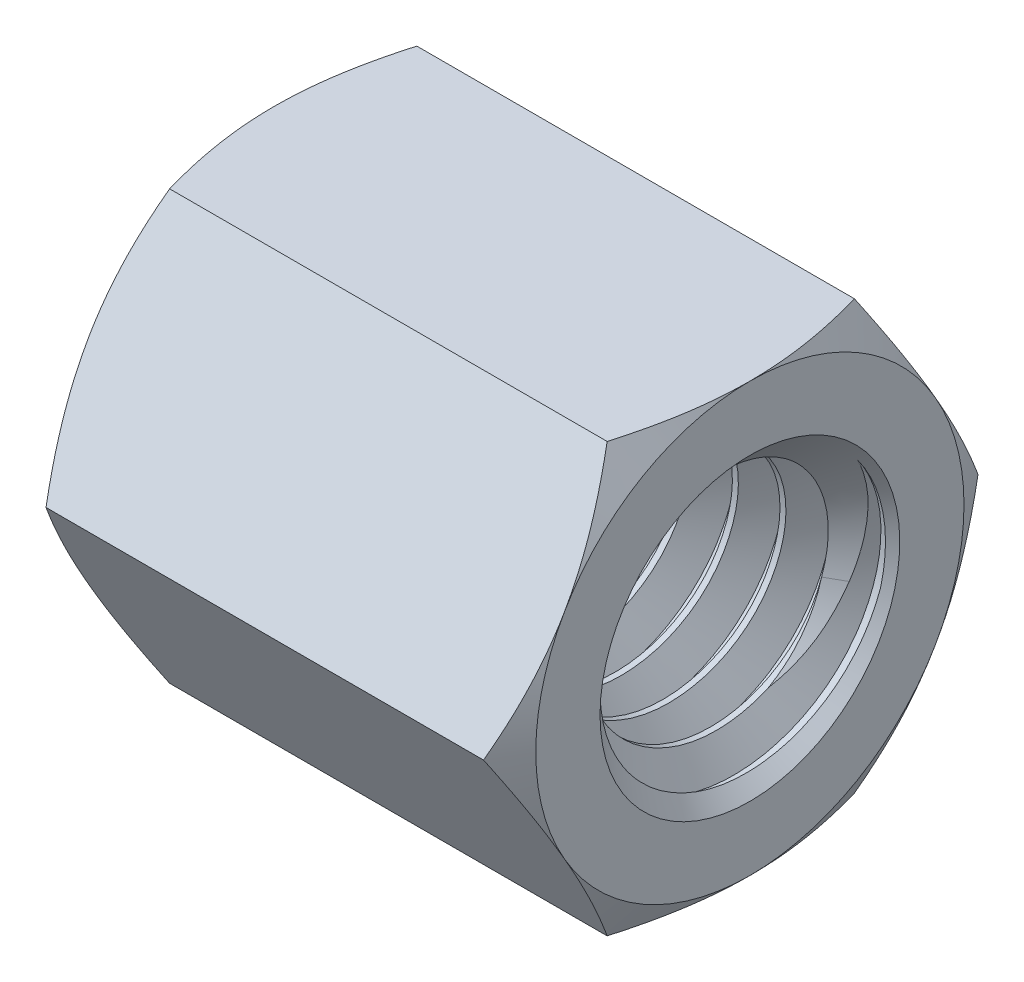
from build123d import *
from build123d.topology import SkipClean

# Parameters (mm, degrees)
BOSS_EXTRUDE1_DEPTH          = 5
SKETCH4_OUTSIDE_W            = 33.378
SKETCH4_OUTSIDE_H            = 32.682
SKETCH4_OUTSIDE_R            = 2.2499999999999987
CUT_EXTRUDE1_DEPTH           = 7.067330549755798
CUT_EXTRUDE1_DRAFT           = -60.000000000000135
SKETCH5_OUTSIDE_W            = 33.378
SKETCH5_OUTSIDE_H            = 32.682
SKETCH5_OUTSIDE_R            = 2.2499999999999987
CUT_EXTRUDE2_DEPTH           = 7.067330549755797
CUT_EXTRUDE2_DRAFT           = -60.000000000000135
SWEEP1_PITCH                 = 0.49999999999999784
SWEEP1_HEIGHT                = 5.500000000000004
SWEEP1_RADIUS                = 1.5000000000000002
SWEEP1_START_ANGLE           = -90.0000000000002
SKETCH8_R                    = 1.5750000000000002
CUT_EXTRUDE3_OTHER_WAY_DEPTH = 7.500868463312053
CUT_EXTRUDE3_OTHER_WAY_TAPER = -45.0000000000001
SKETCH9_R                    = 1.5750000000000002
CUT_EXTRUDE4_OTHER_WAY_DEPTH = 7.067330632164362
CUT_EXTRUDE4_OTHER_WAY_TAPER = -45.0000000000001


with BuildPart() as part:
    # Sketch2 → Boss-Extrude1 (new body)
    with BuildSketch(Plane(origin=(0, 0, 0), x_dir=(0, 0, -1), z_dir=(1, 0, 0))):
        Polygon((1.299038105676657, 2.2499999999999987), (-1.2990381056766587, 2.2499999999999987), (-2.5980762113533147, -1.52e-15), (-1.299038105676657, -2.249999999999999), (1.2990381056766582, -2.2499999999999982), (2.598076211353314, 9.1e-16), align=None)
    extrude(amount=BOSS_EXTRUDE1_DEPTH)

    # Sketch3 → Cut-Revolve1 (revolve, cut)
    with BuildSketch(Plane.XY, mode=Mode.PRIVATE) as cut_revolve1_sk:
        Polygon((4.9e-16, 1.5750000000000002), (0.07499999999999991, 1.5), (4.924999999999997, 1.5), (4.999999999999999, 1.5750000000000002), (4.999999999999999, 0), (0, 0), align=None)
    revolve(cut_revolve1_sk.sketch.rotate(Axis((0, 0, 0), (1, 0, 0)), 90), axis=Axis((0, 0, 0), (1, 0, 0)), mode=Mode.SUBTRACT)


with BuildPart() as cut_extrude1_tool:
    # Sketch4 outside → Cut-Extrude1 (with draft: the straight prism first)
    with BuildSketch(Plane.ZY):
        Rectangle(SKETCH4_OUTSIDE_W, SKETCH4_OUTSIDE_H)
        Circle(SKETCH4_OUTSIDE_R, mode=Mode.SUBTRACT)
    extrude(amount=-CUT_EXTRUDE1_DEPTH)
    # Cut-Extrude1: the draft: its side faces are tilted about the plane it starts from
    cut_extrude1_sides = [cut_extrude1_tool.faces().sort_by_distance(p)[0] for p in [
        (3.533665275, -16.341, 0),
        (3.533665275, 0, 16.689),
        (3.533665275, 16.341, 0),
        (3.533665275, 0, -16.689),
        (3.533665275, 0, -2.25),
    ]]
    draft(cut_extrude1_sides, Plane.ZY, CUT_EXTRUDE1_DRAFT)


with BuildPart() as part_1:
    add(part.part)

    # Cut-Extrude1: cut by cut_extrude1_tool
    add(cut_extrude1_tool.part, mode=Mode.SUBTRACT)


with BuildPart() as cut_extrude2_tool:
    # Sketch5 outside → Cut-Extrude2 (with draft: the straight prism first)
    with BuildSketch(Plane(origin=(4.999999999999999, 0, 0), x_dir=(0, 0, -1), z_dir=(1, 0, 0))):
        Rectangle(SKETCH5_OUTSIDE_W, SKETCH5_OUTSIDE_H)
        Circle(SKETCH5_OUTSIDE_R, mode=Mode.SUBTRACT)
    extrude(amount=-CUT_EXTRUDE2_DEPTH)
    # Cut-Extrude2: the draft: its side faces are tilted about the plane it starts from
    cut_extrude2_sides = [cut_extrude2_tool.faces().sort_by_distance(p)[0] for p in [
        (1.466334725, -16.341, 0),
        (1.466334725, 0, -16.689),
        (1.466334725, 16.341, 0),
        (1.466334725, 0, 16.689),
        (1.466334725, 0, 2.25),
    ]]
    draft(cut_extrude2_sides, Plane(origin=(4.999999999999999, 0, 0), x_dir=(0, 0, -1), z_dir=(1, 0, 0)), CUT_EXTRUDE2_DRAFT)


with BuildPart() as part_2:
    add(part_1.part)

    # Cut-Extrude2: cut by cut_extrude2_tool
    add(cut_extrude2_tool.part, mode=Mode.SUBTRACT)

    # Sweep1: sweep along a helix
    with BuildLine() as sweep1_path:
        add(Helix(SWEEP1_PITCH, SWEEP1_HEIGHT, SWEEP1_RADIUS, center=(0, 0, 0), direction=(1, 0, 0), mode=Mode.PRIVATE).rotate(Axis((0, 0, 0), (1, 0, 0)), SWEEP1_START_ANGLE))
    # Sketch6 → Sweep1 (sweep)
    with BuildSketch(Plane.XY):
        Polygon((-0.44587341226347, 1.5312499999999998), (0.01804219591217864, 1.5312499999999993), (-0.18266560817564578, 1.1836138858443077), (-0.24516560817564567, 1.1836138858443077), align=None)
    sweep(path=sweep1_path.line, is_frenet=True)

    # Cut-Extrude3 cone 1 section (through the dimple's axis) → Cut-Extrude3 (revolve, cut)
    with BuildSketch(Plane.ZX):
        Polygon((0, 0), (1.575, 0), (0, 1.575), align=None)
    revolve(axis=Axis((0, 0, 0), (1, 0, 0)), mode=Mode.SUBTRACT)

    # Sketch8 → Cut-Extrude3 other way (cut)
    with BuildSketch(Plane.ZY):
        Circle(SKETCH8_R)
    extrude(amount=CUT_EXTRUDE3_OTHER_WAY_DEPTH, taper=CUT_EXTRUDE3_OTHER_WAY_TAPER, mode=Mode.SUBTRACT)

    # Cut-Extrude4 cone 1 section (through the dimple's axis) → Cut-Extrude4 (revolve, cut)
    with SkipClean():  # the faces are left unmerged after this step: merging them gives an invalid solid
        with BuildSketch(Plane(origin=(5, 0, 0), x_dir=(0, 0, -1), z_dir=(0, 1, 0))):
            Polygon((0, 0), (1.575, 0), (0, 1.575), align=None)
        revolve(axis=Axis((5, 0, 0), (-1, 0, 0)), mode=Mode.SUBTRACT)

    # Sketch9 → Cut-Extrude4 other way (cut)
    with SkipClean():  # the faces are left unmerged after this step: merging them gives an invalid solid
        with BuildSketch(Plane(origin=(4.999999999999999, 0, 0), x_dir=(0, 0, -1), z_dir=(1, 0, 0))):
            Circle(SKETCH9_R)
        extrude(amount=CUT_EXTRUDE4_OTHER_WAY_DEPTH, taper=CUT_EXTRUDE4_OTHER_WAY_TAPER, mode=Mode.SUBTRACT)


solid = part_2.part
